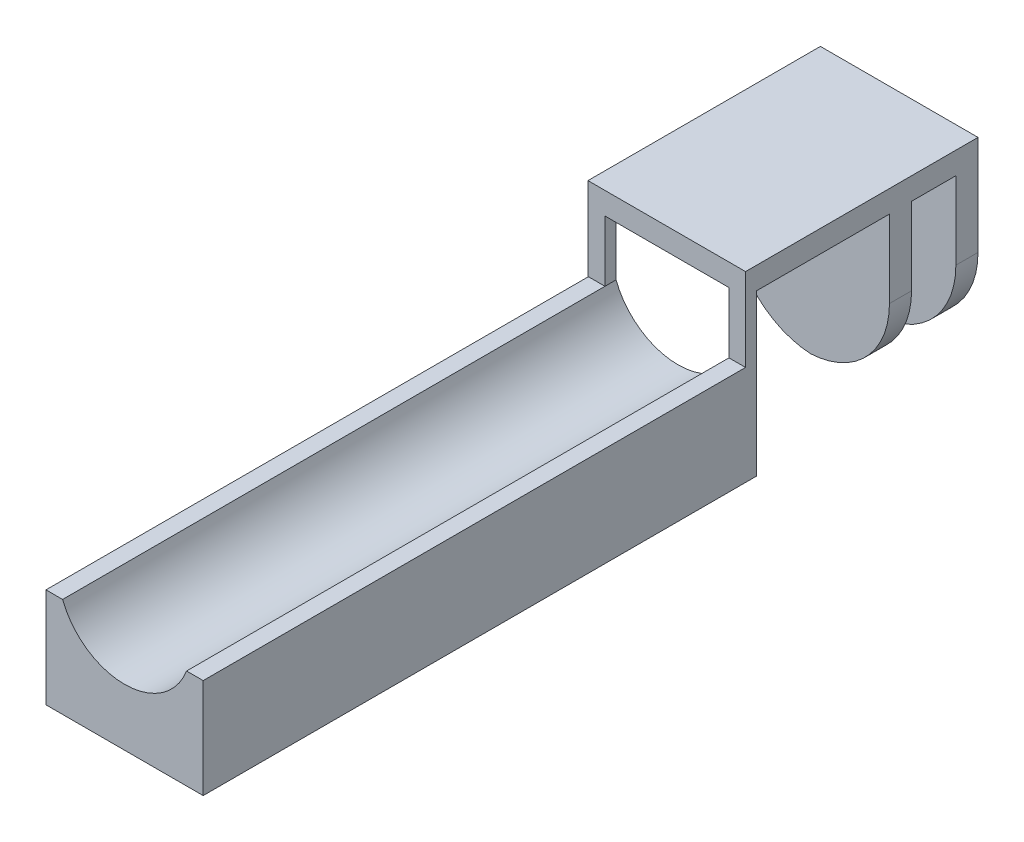
from build123d import *

# Parameters (mm, degrees)
BOSS_EXTRUDE1_DEPTH = 1000
BOSS_EXTRUDE2_DEPTH = 20
SKETCH3_W           = 284.767845469
SKETCH3_H           = 40
BOSS_EXTRUDE4_DEPTH = 400
SKETCH4_W           = 284.767845469
SKETCH4_H           = 40
BOSS_EXTRUDE5_DEPTH = 290
SKETCH7_R           = 12
CUT_EXTRUDE1_DEPTH  = 372
FILLET1_R           = 150


with BuildPart() as part:
    # Sketch1 → Boss-Extrude1 (new body)
    with BuildSketch(Plane.XY):
        with BuildLine():
            Line((-223.996890487, 0), (-253.996890487, 0))
            Line((-253.996890487, 0), (-253.996890487, -180))
            Line((-253.996890487, -180), (30, -180))
            Line((30, -180), (30, 0))
            Line((30, 0), (0, 0))
            ThreePointArc((0, 0), (-111.998445243, -76.914639806), (-223.996890487, 0))
        make_face()
    extrude(amount=BOSS_EXTRUDE1_DEPTH)

    # Sketch2 → Boss-Extrude2 (add)
    with BuildSketch(Plane(origin=(0, 0, 0), x_dir=(-1, 0, 0), z_dir=(0, 0, -1))):
        Polygon((-30, 110), (-30, 0), (0, 0), (0, 110), (223.996890487, 110), (223.996890487, 0), (253.996890487, 0), (254.767845469, 0), (254.767845469, 110), (254.767845469, 150), (223.996890487, 150), (0, 150), (-30, 150), align=None)
    extrude(amount=-BOSS_EXTRUDE2_DEPTH)

    # Sketch3 → Boss-Extrude4 (add)
    with BuildSketch(Plane(origin=(0, 0, 0), x_dir=(-1, 0, 0), z_dir=(0, 0, -1))):
        with Locations((112.383922735, 130)):
            Rectangle(SKETCH3_W, SKETCH3_H)
    extrude(amount=BOSS_EXTRUDE4_DEPTH)

    # Sketch4 → Boss-Extrude5 (add)
    with BuildSketch(Plane.XZ.offset(-110)):
        with Locations((-112.383922735, -380)):
            Rectangle(SKETCH4_W, SKETCH4_H)
        with Locations((-112.383922735, -260)):
            Rectangle(SKETCH4_W, SKETCH4_H)
    extrude(amount=BOSS_EXTRUDE5_DEPTH)

    # Sketch7 → Cut-Extrude1 (cut)
    with BuildSketch(Plane(origin=(0, 0, -400), x_dir=(-1, 0, 0), z_dir=(0, 0, -1))):
        with Locations((111.998445243, 43.085360194)):
            Circle(SKETCH7_R)
    extrude(amount=-CUT_EXTRUDE1_DEPTH, mode=Mode.SUBTRACT)

    # Fillet1
    # the kernel refuses this fillet: 150 mm, written as the material it takes off along each edge
    with BuildSketch(Plane(origin=(-254.767845469, -180, 15), x_dir=(0, 1, 0), z_dir=(0, 0, -1))) as fillet1_piece_1_section:
        with BuildLine():
            CenterArc((FILLET1_R, FILLET1_R), FILLET1_R, 180, 90)
            Line((0, FILLET1_R), (0, 0))
            Line((0, 0), (FILLET1_R, 0))
        make_face()
    fillet1_piece_1 = extrude(amount=790, mode=Mode.PRIVATE)
    fillet1_piece_1 = split(fillet1_piece_1, bisect_by=Plane(origin=(-254.387947187, -110.019667164, -240), z_dir=(0, 0, -1)), keep=Keep.TOP, mode=Mode.PRIVATE)
    add(fillet1_piece_1, mode=Mode.SUBTRACT)
    with BuildSketch(Plane(origin=(30, -180, -775), x_dir=(0, 1, 0), z_dir=(0, 0, 1))) as fillet1_piece_2_section:
        with BuildLine():
            CenterArc((FILLET1_R, FILLET1_R), FILLET1_R, 180, 90)
            Line((0, FILLET1_R), (0, 0))
            Line((0, 0), (FILLET1_R, 0))
        make_face()
    fillet1_piece_2 = extrude(amount=790, mode=Mode.PRIVATE)
    fillet1_piece_2 = split(fillet1_piece_2, bisect_by=Plane(origin=(-3.505190842, -146.494809158, -240), z_dir=(0, 0, -1)), keep=Keep.TOP, mode=Mode.PRIVATE)
    add(fillet1_piece_2, mode=Mode.SUBTRACT)
    with BuildSketch(Plane(origin=(-254.767845469, -180, -655), x_dir=(0, 1, 0), z_dir=(0, 0, 1)), Plane(origin=(30, -180, -240), x_dir=(0, 1, 0), z_dir=(0, 0, -1))) as fillet1_piece_3:
        with BuildLine():
            CenterArc((FILLET1_R, -FILLET1_R), FILLET1_R, 90, 90)
            Line((0, -FILLET1_R), (0, 0))
            Line((0, 0), (FILLET1_R, 0))
        make_face()
    extrude(amount=415, mode=Mode.SUBTRACT)


solid = part.part
